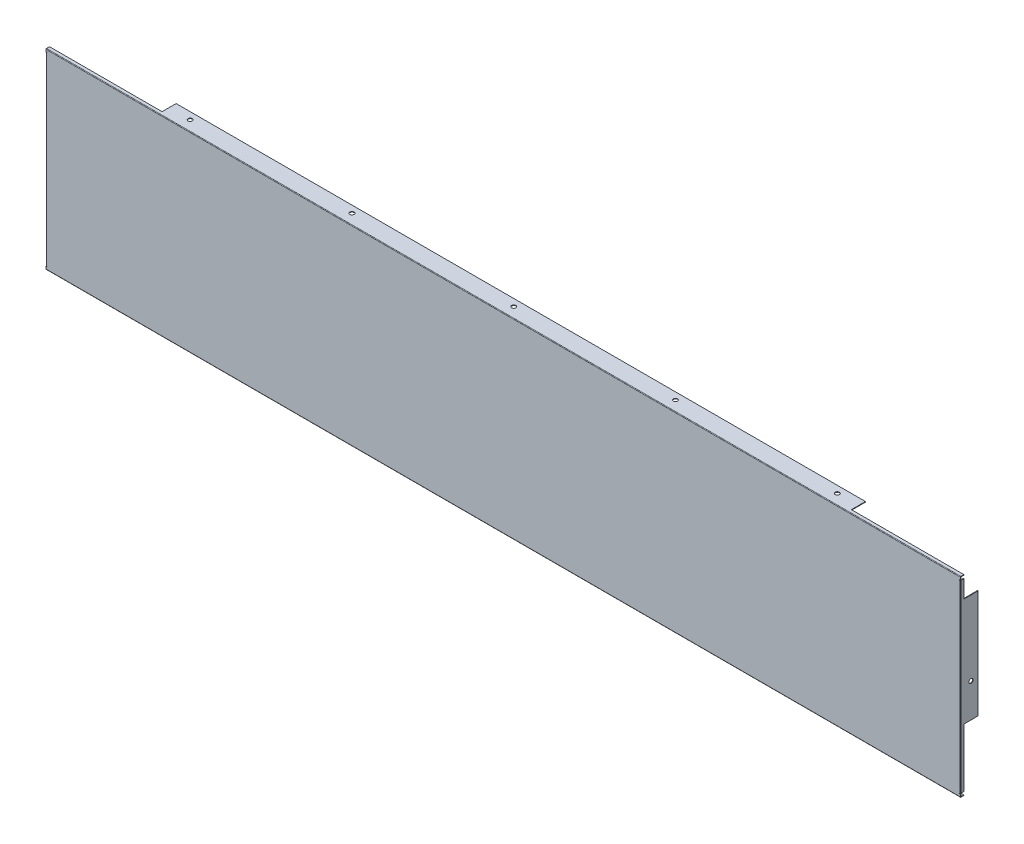
from build123d import *

# Parameters (mm, degrees)
SKETCH_1_W                   = 1300
SKETCH_1_H                   = 272
SM_BASE_FLANGE_1_DEPTH       = 0.8
SM_START                     = -650
SM_EDGE_FLANGE_1_DEPTH       = 1300
SM_START_2                   = -490
SM_EDGE_FLANGE_1_2_OUTLINE_W = 0.8
SM_EDGE_FLANGE_1_2_OUTLINE_H = 24.2
SM_EDGE_FLANGE_1_2_DEPTH     = 980
SM_EDGE_FLANGE_1_3_OUTLINE_W = 0.8
SM_EDGE_FLANGE_1_3_OUTLINE_H = 4.2
SM_EDGE_FLANGE_1_3_DEPTH     = 1300
SKETCH_11_R                  = 3
CUT_EXTRUDE_1_DEPTH          = 706.059571951
SM_START_3                   = -131.8
SM_EDGE_FLANGE_2_DEPTH       = 263.6
SM_EDGE_FLANGE_2_2_DEPTH     = 0.8
SM_START_4                   = 131
SM_EDGE_FLANGE_2_3_DEPTH     = 0.8
SM_START_5                   = -48
SM_EDGE_FLANGE_2_4_OUTLINE_W = 0.8
SM_EDGE_FLANGE_2_4_OUTLINE_H = 24.2
SM_EDGE_FLANGE_2_4_DEPTH     = 154
SM_START_6                   = -131
SM_EDGE_FLANGE_2_5_OUTLINE_W = 0.8
SM_EDGE_FLANGE_2_5_OUTLINE_H = 4.2
SM_EDGE_FLANGE_2_5_DEPTH     = 262
SKETCH_15_R                  = 3
CUT_EXTRUDE_2_DEPTH          = 1308.33354581


# Read off the part's stored shape, not the designer's step: 边线-法兰1, 边线-法兰2
# Sheet-metal steps are written as plain solids
with BuildPart() as part:
    # Sketch 1 → 基体-法兰1 (new body)
    with BuildSketch(Plane.XY):
        Rectangle(SKETCH_1_W, SKETCH_1_H)
    extrude(amount=-SM_BASE_FLANGE_1_DEPTH)

    # 边线-法兰1 outline → 边线-法兰1 (cut)
    with BuildSketch(Plane.YZ.offset(SM_START)):
        with BuildLine():
            Line((136, 0), (135.2, 0))
            ThreePointArc((135.2, 0), (135.765685425, -0.234314575), (136, -0.8))
            Line((136, -0.8), (136, 0))
        make_face()
    sm_edge_flange_1 = extrude(amount=SM_EDGE_FLANGE_1_DEPTH, mode=Mode.SUBTRACT)

    # Sm Edge Flange 1 2 outline → Sm Edge Flange 1 2 (add)
    with BuildSketch(Plane.YZ.offset(SM_START_2)):
        with Locations((135.6, -12.9)):
            Rectangle(SM_EDGE_FLANGE_1_2_OUTLINE_W, SM_EDGE_FLANGE_1_2_OUTLINE_H)
    sm_edge_flange_1_2 = extrude(amount=SM_EDGE_FLANGE_1_2_DEPTH)

    # Sm Edge Flange 1 3 outline → Sm Edge Flange 1 3 (add)
    with BuildSketch(Plane.YZ.offset(SM_START)):
        with Locations((135.6, -2.9)):
            Rectangle(SM_EDGE_FLANGE_1_3_OUTLINE_W, SM_EDGE_FLANGE_1_3_OUTLINE_H)
    sm_edge_flange_1_3 = extrude(amount=SM_EDGE_FLANGE_1_3_DEPTH)

    # 镜向1: 边线-法兰1, Sm Edge Flange 1 2, Sm Edge Flange 1 3 across plane
    add(sm_edge_flange_1.mirror(Plane.ZX), mode=Mode.SUBTRACT)
    add(sm_edge_flange_1_2.mirror(Plane.ZX))
    add(sm_edge_flange_1_3.mirror(Plane.ZX))

    # 草图11 → 切除-拉伸1 (cut, through all)
    with BuildSketch(Plane(origin=(0, 136, 0), x_dir=(1, 0, 0), z_dir=(0, 1, 0))):
        with Locations(Location((0, 15, 0), (0, 0, 270))):
            Circle(SKETCH_11_R)
        with Locations(Location((230, 15, 0), (0, 0, 270))):
            Circle(SKETCH_11_R)
        with Locations(Location((460, 15, 0), (0, 0, 270))):
            Circle(SKETCH_11_R)
        with Locations(Location((-230, 15, 0), (0, 0, 270))):
            Circle(SKETCH_11_R)
        with Locations(Location((-460, 15, 0), (0, 0, 270))):
            Circle(SKETCH_11_R)
    extrude(amount=-CUT_EXTRUDE_1_DEPTH, mode=Mode.SUBTRACT)

    # 边线-法兰2 outline → 边线-法兰2 (cut)
    with BuildSketch(Plane(origin=(0, 0, 0), x_dir=(1, 0, 0), z_dir=(0, 1, 0)).offset(SM_START_3)):
        with BuildLine():
            ThreePointArc((-649.2, 0), (-649.765685425, 0.234314575), (-650, 0.8))
            Line((-650, 0.8), (-650, 0))
            Line((-650, 0), (-649.2, 0))
        make_face()
    sm_edge_flange_2 = extrude(amount=SM_EDGE_FLANGE_2_DEPTH, mode=Mode.SUBTRACT)

    # Sm Edge Flange 2 2 outline → Sm Edge Flange 2 2 (cut)
    with BuildSketch(Plane(origin=(0, 0, 0), x_dir=(1, 0, 0), z_dir=(0, 1, 0)).offset(SM_START_3)):
        with BuildLine():
            Line((-648.4, 0.8), (-650, 0.8))
            ThreePointArc((-650, 0.8), (-649.765685425, 0.234314575), (-649.2, 0))
            Line((-649.2, 0), (-648.4, 0))
            Line((-648.4, 0), (-648.4, 0.8))
        make_face()
    sm_edge_flange_2_2 = extrude(amount=SM_EDGE_FLANGE_2_2_DEPTH, mode=Mode.SUBTRACT)

    # Sm Edge Flange 2 3 outline → Sm Edge Flange 2 3 (cut)
    with BuildSketch(Plane(origin=(0, 0, 0), x_dir=(1, 0, 0), z_dir=(0, 1, 0)).offset(SM_START_4)):
        with BuildLine():
            Line((-648.4, 0.8), (-650, 0.8))
            ThreePointArc((-650, 0.8), (-649.765685425, 0.234314575), (-649.2, 0))
            Line((-649.2, 0), (-648.4, 0))
            Line((-648.4, 0), (-648.4, 0.8))
        make_face()
    sm_edge_flange_2_3 = extrude(amount=SM_EDGE_FLANGE_2_3_DEPTH, mode=Mode.SUBTRACT)

    # Sm Edge Flange 2 4 outline → Sm Edge Flange 2 4 (add)
    with BuildSketch(Plane(origin=(0, 0, 0), x_dir=(1, 0, 0), z_dir=(0, 1, 0)).offset(SM_START_5)):
        with Locations((-649.6, 12.9)):
            Rectangle(SM_EDGE_FLANGE_2_4_OUTLINE_W, SM_EDGE_FLANGE_2_4_OUTLINE_H)
    sm_edge_flange_2_4 = extrude(amount=SM_EDGE_FLANGE_2_4_DEPTH)

    # Sm Edge Flange 2 5 outline → Sm Edge Flange 2 5 (add)
    with BuildSketch(Plane(origin=(0, 0, 0), x_dir=(1, 0, 0), z_dir=(0, 1, 0)).offset(SM_START_6)):
        with Locations((-649.6, 2.9)):
            Rectangle(SM_EDGE_FLANGE_2_5_OUTLINE_W, SM_EDGE_FLANGE_2_5_OUTLINE_H)
    sm_edge_flange_2_5 = extrude(amount=SM_EDGE_FLANGE_2_5_DEPTH)

    # 镜向2: 边线-法兰2, Sm Edge Flange 2 2, Sm Edge Flange 2 3, Sm Edge Flange 2 4, Sm Edge Flange 2 5 across plane
    add(sm_edge_flange_2.mirror(Plane(origin=(0, 0, 0), x_dir=(0, 0, 1), z_dir=(1, 0, 0))), mode=Mode.SUBTRACT)
    add(sm_edge_flange_2_2.mirror(Plane(origin=(0, 0, 0), x_dir=(0, 0, 1), z_dir=(1, 0, 0))), mode=Mode.SUBTRACT)
    add(sm_edge_flange_2_3.mirror(Plane(origin=(0, 0, 0), x_dir=(0, 0, 1), z_dir=(1, 0, 0))), mode=Mode.SUBTRACT)
    add(sm_edge_flange_2_4.mirror(Plane(origin=(0, 0, 0), x_dir=(0, 0, 1), z_dir=(1, 0, 0))))
    add(sm_edge_flange_2_5.mirror(Plane(origin=(0, 0, 0), x_dir=(0, 0, 1), z_dir=(1, 0, 0))))

    # 草图15 → 切除-拉伸2 (cut, through all)
    with BuildSketch(Plane.ZY.offset(650)):
        with Locations((-15, 0)):
            Circle(SKETCH_15_R)
    extrude(amount=-CUT_EXTRUDE_2_DEPTH, mode=Mode.SUBTRACT)


solid = part.part
